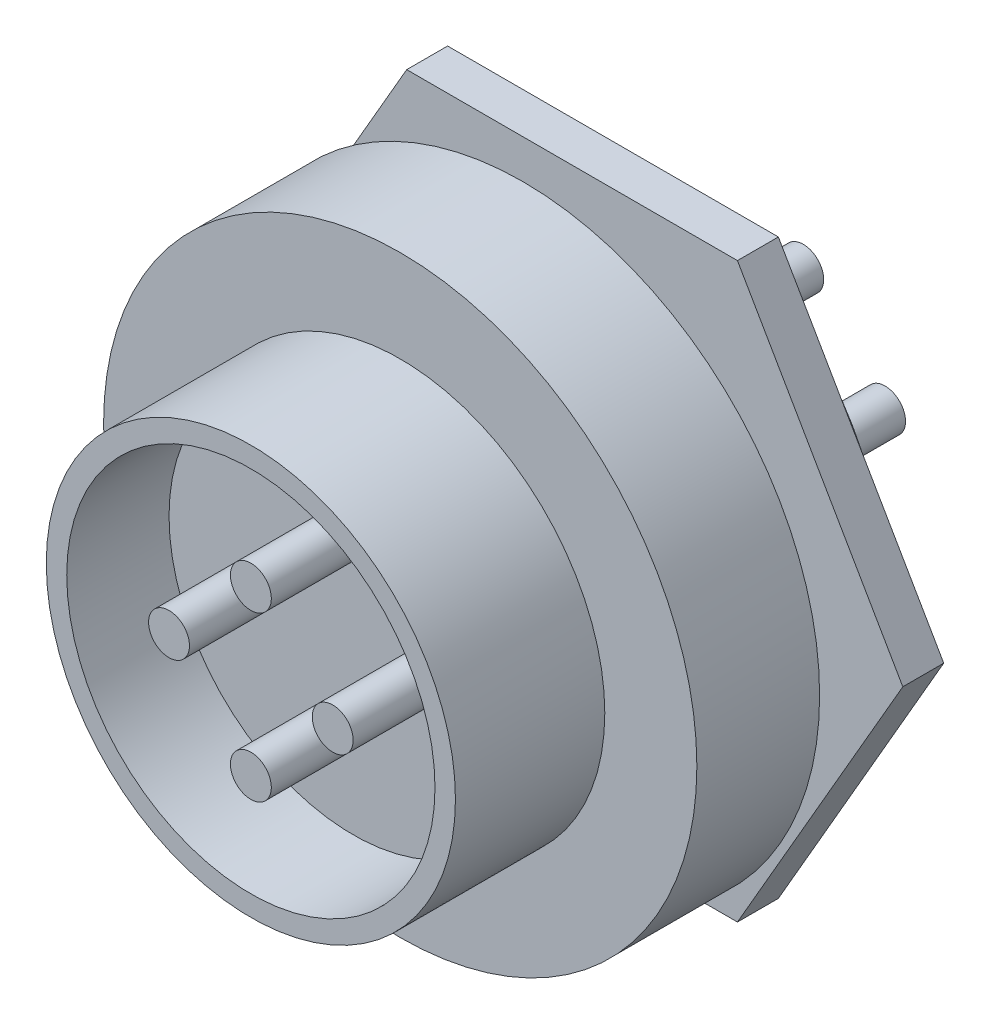
from build123d import *

# Parameters (mm, degrees)
DODANIE_WYCI_GNI_CIE1_DEPTH       = 2.4
SZKIC2_R                          = 14.5
DODANIE_WYCI_GNI_CIE2_DEPTH       = 6
SZKIC3_R                          = 10
DODANIE_WYCI_GNI_CIE3_DEPTH       = 7.3
DODANIE_WYCI_GNI_CIE4_START       = -5
DODANIE_WYCI_GNI_CIE4_OUTLINE_R   = 9
DODANIE_WYCI_GNI_CIE4_OUTLINE_R_2 = 1
DODANIE_WYCI_GNI_CIE4_DEPTH       = 5
DODANIE_WYCI_GNI_CIE5_DEPTH       = 2
DODANIE_WYCI_GNI_CIE6_START       = 7
SZKIC6_R                          = 10.5
DODANIE_WYCI_GNI_CIE6_DEPTH       = 2.6
DODANIE_WYCI_GNI_CIE7_START       = 6.7
SZKIC7_R                          = 1
DODANIE_WYCI_GNI_CIE7_DEPTH       = 6.7


# Read off the part's stored shape, not the designer's step: Dodanie-wyciągnięcie4
with BuildPart() as part:
    # Szkic1 → Dodanie-wyciągnięcie1 (new body)
    with BuildSketch(Plane.XY):
        with BuildLine():
            Line((-4.019950248, 9.7), (4.019950248, 9.7))
            ThreePointArc((4.019950248, 9.7), (0, -10.5), (-4.019950248, 9.7))
        make_face()
    extrude(amount=DODANIE_WYCI_GNI_CIE1_DEPTH)

    # Szkic2 → Dodanie-wyciągnięcie2 (add)
    with BuildSketch(Plane.XY.offset(2.4)):
        Circle(SZKIC2_R)
    extrude(amount=DODANIE_WYCI_GNI_CIE2_DEPTH)

    # Szkic3 → Dodanie-wyciągnięcie3 (add)
    with BuildSketch(Plane.XY.offset(8.4)):
        with Locations(Location((0, 0, 0), (0, 0, 180))):
            Circle(SZKIC3_R)
    extrude(amount=DODANIE_WYCI_GNI_CIE3_DEPTH)

    # Dodanie-wyciągnięcie4 outline → Dodanie-wyciągnięcie4 (cut)
    with BuildSketch(Plane.XY.offset(15.7).offset(DODANIE_WYCI_GNI_CIE4_START)):
        Circle(DODANIE_WYCI_GNI_CIE4_OUTLINE_R)
        with Locations((0, -4)):
            Circle(DODANIE_WYCI_GNI_CIE4_OUTLINE_R_2, mode=Mode.SUBTRACT)
        with Locations((-4, 0)):
            Circle(DODANIE_WYCI_GNI_CIE4_OUTLINE_R_2, mode=Mode.SUBTRACT)
        with Locations((4, 0)):
            Circle(DODANIE_WYCI_GNI_CIE4_OUTLINE_R_2, mode=Mode.SUBTRACT)
        with Locations((0, 4)):
            Circle(DODANIE_WYCI_GNI_CIE4_OUTLINE_R_2, mode=Mode.SUBTRACT)
    extrude(amount=DODANIE_WYCI_GNI_CIE4_DEPTH, mode=Mode.SUBTRACT)

    # Szkic5 → Dodanie-wyciągnięcie5 (add)
    with BuildSketch(Plane(origin=(0, 0, 0), x_dir=(-1, 0, 0), z_dir=(0, 0, -1))):
        Polygon((8.082903769, 14), (-8.082903769, 14), (-16.165807537, 0), (-8.082903769, -14), (8.082903769, -14), (16.165807537, 0), align=None)
    extrude(amount=DODANIE_WYCI_GNI_CIE5_DEPTH)

    # Szkic6 → Dodanie-wyciągnięcie6 (add)
    with BuildSketch(Plane(origin=(0, 0, 2.4), x_dir=(-1, 0, 0), z_dir=(0, 0, -1)).offset(DODANIE_WYCI_GNI_CIE6_START)):
        Circle(SZKIC6_R)
    extrude(amount=-DODANIE_WYCI_GNI_CIE6_DEPTH)

    # Szkic7 → Dodanie-wyciągnięcie7 (add)
    with BuildSketch(Plane(origin=(0, 0, -4.6), x_dir=(-1, 0, 0), z_dir=(0, 0, -1)).offset(DODANIE_WYCI_GNI_CIE7_START)):
        with Locations(Location((0, -4, 0), (0, 0, 180))):
            Circle(SZKIC7_R)
        with Locations(Location((4, 0, 0), (0, 0, 180))):
            Circle(SZKIC7_R)
        with Locations(Location((0, 4, 0), (0, 0, 180))):
            Circle(SZKIC7_R)
        with Locations(Location((-4, 0, 0), (0, 0, 180))):
            Circle(SZKIC7_R)
    extrude(amount=-DODANIE_WYCI_GNI_CIE7_DEPTH)


solid = part.part
